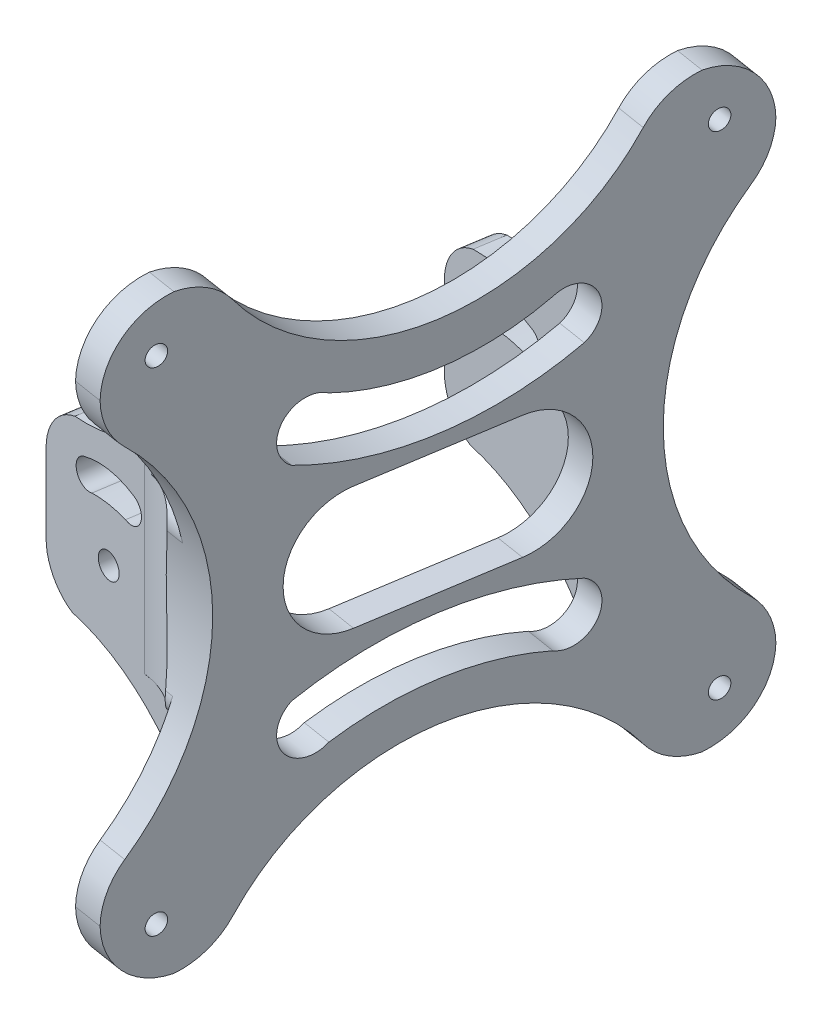
from build123d import *

# Parameters (mm, degrees)
ESQUISSE2_W                  = 37
ESQUISSE2_H                  = 36
ESQUISSE2_R                  = 2.55
BOSS_EXTRU_1_DEPTH           = 6
ESQUISSE8_W                  = 37
ESQUISSE8_H                  = 36
ESQUISSE8_R                  = 2.55
BOSS_EXTRU_3_DEPTH           = 6
ESQUISSE7_W                  = 120
ESQUISSE7_H                  = 120
ESQUISSE7_R                  = 2
BOSS_EXTRU_5_DEPTH           = 6
ESQUISSE13_W                 = 21.641206158
ESQUISSE13_H                 = 35.892950949
ESQUISSE13_W_2               = 21.658793842
ESQUISSE13_H_2               = 36.059743372
BOSS_EXTRU_6_DEPTH           = 13
ENL_V_MAT_EXTRU_1_DEPTH      = 13
ENL_V_MAT_EXTRU_1_DEPTH_BACK = 10
ENL_V_MAT_EXTRU_2_DEPTH      = 10
CONG_1_R                     = 14
CONG_2_R                     = 10
ESQUISSE16_W                 = 6
ESQUISSE16_H                 = 19
ESQUISSE16_H_2               = 20
BOSS_EXTRU_7_DEPTH           = 37
ENL_V_MAT_EXTRU_5_DEPTH      = 102
ESQUISSE11_R                 = 3.6
ENL_V_MAT_EXTRU_3_DEPTH      = 2
CONG_3_START                 = 37
CONG_3_DEPTH                 = 13
ENL_V_MAT_EXTRU_6_DEPTH      = 10
ENL_V_MAT_EXTRU_7_DEPTH      = 60


with BuildPart() as part:
    # Esquisse2 → Boss.-Extru.1 (new body)
    with BuildSketch(Plane(origin=(0.906224424, 0, -5.721675829), x_dir=(0.9876883405951378, 0, 0.15643446504023084), z_dir=(-0.15643446504023084, 0, 0.9876883405951378))):
        with Locations((31.5, -4.155063291)):
            Rectangle(ESQUISSE2_W, ESQUISSE2_H)
        with Locations(Location((28.3, -8.155063291, 0), (0, 0, 180))):
            Circle(ESQUISSE2_R, mode=Mode.SUBTRACT)
        with BuildLine():
            ThreePointArc((34.496035861, 7.577601288), (36.106578838, 3.890320367), (32.419297917, 2.27977739))
            ThreePointArc((32.419297917, 2.27977739), (28.322675088, 2.630124236), (24.226052259, 2.27977739))
            ThreePointArc((24.226052259, 2.27977739), (20.538771338, 3.890320367), (22.149314314, 7.577601288))
            ThreePointArc((22.149314314, 7.577601288), (28.322675088, 8.74435419), (34.496035861, 7.577601288))
        make_face(mode=Mode.SUBTRACT)
    extrude(amount=BOSS_EXTRU_1_DEPTH)



with BuildPart() as body_2:
    # Esquisse8 → Boss.-Extru.3 (new body)
    with BuildSketch(Plane(origin=(11.027534312, 0, -69.625111466), x_dir=(-0.9876883405951388, 0, -0.15643446504022476), z_dir=(0.15643446504022476, 0, -0.9876883405951388))):
        with Locations((-31.5, -4.155063291)):
            Rectangle(ESQUISSE8_W, ESQUISSE8_H)
        with Locations((-28.3, -8.155063291)):
            Circle(ESQUISSE8_R, mode=Mode.SUBTRACT)
        with BuildLine():
            ThreePointArc((-22.149314314, 7.577601288), (-20.538771338, 3.890320367), (-24.226052259, 2.27977739))
            ThreePointArc((-24.226052259, 2.27977739), (-28.322675088, 2.640604629), (-32.419297917, 2.27977739))
            ThreePointArc((-32.419297917, 2.27977739), (-36.106578838, 3.890320367), (-34.496035861, 7.577601288))
            ThreePointArc((-34.496035861, 7.577601288), (-28.322675088, 8.74435419), (-22.149314314, 7.577601288))
        make_face(mode=Mode.SUBTRACT)
    extrude(amount=BOSS_EXTRU_3_DEPTH)


with BuildPart() as part_1:
    add(part.part)

    add(body_2.part)  # Boss.-Extru.5 merges body 2
    # Esquisse7 → Boss.-Extru.5 (add)
    with BuildSketch(Plane(origin=(49.38441703, 0, 7.821723252), x_dir=(0.1564344650402309, 0, -0.9876883405951378), z_dir=(0.9876883405951379, 0, 0.1564344650402309))):
        with Locations((38.134203396, -0.53448162)):
            Rectangle(ESQUISSE7_W, ESQUISSE7_H)
        with Locations((-11.865796604, 49.46551838)):
            Circle(ESQUISSE7_R, mode=Mode.SUBTRACT)
        with Locations((88.134203396, 49.46551838)):
            Circle(ESQUISSE7_R, mode=Mode.SUBTRACT)
        with Locations((88.134203396, -50.53448162)):
            Circle(ESQUISSE7_R, mode=Mode.SUBTRACT)
        with Locations((-11.865796604, -50.53448162)):
            Circle(ESQUISSE7_R, mode=Mode.SUBTRACT)
    extrude(amount=BOSS_EXTRU_5_DEPTH)

    # Esquisse13 → Boss.-Extru.6 (add)
    with BuildSketch(Plane(origin=(49.38441703, 0, 7.821723252), x_dir=(-0.1564344650402309, 0, 0.9876883405951378), z_dir=(-0.9876883405951379, 0, -0.1564344650402309))):
        with Locations((-87.313600317, -4.101538765)):
            Rectangle(ESQUISSE13_W, ESQUISSE13_H)
        with Locations((11.036399683, -4.184934977)):
            Rectangle(ESQUISSE13_W_2, ESQUISSE13_H_2)
    extrude(amount=BOSS_EXTRU_6_DEPTH)

    # Esquisse9 → Enlèv. mat.-Extru.1 (cut, two sides: drawn at the far end of the back side and taken through both)
    with BuildSketch(Plane(origin=(49.38441703, 0, 7.821723252), x_dir=(-0.1564344650402309, 0, 0.9876883405951378), z_dir=(-0.9876883405951379, 0, -0.1564344650402309)).offset(-ENL_V_MAT_EXTRU_1_DEPTH_BACK)):
        with BuildLine():
            Line((-98.134203396, 39.46551838), (-98.134203396, -40.53448162))
            ThreePointArc((-98.134203396, -40.53448162), (-78.134203396, -0.53448162), (-98.134203396, 39.46551838))
        make_face()
        with BuildLine():
            Line((-78.134203396, -60.53448162), (1.865796604, -60.53448162))
            ThreePointArc((1.865796604, -60.53448162), (-38.134203396, -36.150009748), (-78.134203396, -60.53448162))
        make_face()
        with BuildLine():
            Line((21.865796604, 39.46551838), (21.865796604, -40.53448162))
            ThreePointArc((21.865796604, -40.53448162), (1.865796604, -0.53448162), (21.865796604, 39.46551838))
        make_face()
        with BuildLine():
            Line((1.865796604, 59.46551838), (-78.134203396, 59.46551838))
            ThreePointArc((-78.134203396, 59.46551838), (-38.134203396, 35.081046508), (1.865796604, 59.46551838))
        make_face()
    extrude(amount=ENL_V_MAT_EXTRU_1_DEPTH + ENL_V_MAT_EXTRU_1_DEPTH_BACK, mode=Mode.SUBTRACT)

    # Esquisse10 → Enlèv. mat.-Extru.2 (cut)
    with BuildSketch(Plane(origin=(49.38441703, 0, 7.821723252), x_dir=(-0.1564344650402309, 0, 0.9876883405951378), z_dir=(-0.9876883405951379, 0, -0.1564344650402309))):
        with BuildLine():
            Line((-53.134203396, 11.96551838), (-23.134203396, 11.96551838))
            ThreePointArc((-23.134203396, 11.96551838), (-10.634203396, -0.53448162), (-23.134203396, -13.03448162))
            Line((-23.134203396, -13.03448162), (-53.134203396, -13.03448162))
            ThreePointArc((-53.134203396, -13.03448162), (-65.634203396, -0.53448162), (-53.134203396, 11.96551838))
        make_face()
    extrude(amount=-ENL_V_MAT_EXTRU_2_DEPTH, mode=Mode.SUBTRACT)

    # Congé1
    # the kernel refuses this fillet: 14 mm, written as the material it takes off along each edge
    with BuildSketch(Plane(origin=(74.224993646, 59.46551838, 13.64513807), x_dir=(-0.156434465040231, -1.8269890380239846e-15, 0.9876883405951377), z_dir=(-0.9876883405951377, 0, -0.15643446504023098))) as cong_1_piece_1:
        with BuildLine():
            CenterArc((7.778292272, -14), CONG_1_R, 90, 54.076548206)
            ThreePointArc((-3.558929623, -5.786145868), (-1.67012678, -2.960324325), (0, 0))
            Line((0, 0), (7.778292272, 0))
        make_face()
    extrude(amount=44.891461359, mode=Mode.SUBTRACT)
    with BuildSketch(Plane(origin=(42.400977873, 59.46551838, -72.392500921), x_dir=(-0.0819572414762967, -0.8517749604527707, 0.517457657509556), z_dir=(0.9876883405951377, 0, 0.15643446504023104))) as cong_1_piece_2:
        with BuildLine():
            CenterArc((7.849741203, 13.960064244), CONG_1_R, 211.594748122, 54.076548206)
            Line((-4.075108243, 6.625354592), (0, 0))
            ThreePointArc((0, 0), (3.396522636, 0.128364929), (6.793045272, 0))
        make_face()
    extrude(amount=44.891461359, mode=Mode.SUBTRACT)
    with BuildSketch(Plane(origin=(30.166896719, 59.46551838, -94.579491533), x_dir=(-0.15643446504023087, 0, 0.9876883405951378), z_dir=(0.9876883405951378, 0, 0.15643446504023087))) as cong_1_piece_3:
        with BuildLine():
            CenterArc((CONG_1_R, CONG_1_R), CONG_1_R, 180, 90)
            Line((0, CONG_1_R), (0, 0))
            Line((0, 0), (CONG_1_R, 0))
        make_face()
    extrude(amount=76, mode=Mode.SUBTRACT)
    with BuildSketch(Plane(origin=(86.652299455, -40.53448162, -85.633082634), x_dir=(-0.11956994947595972, 0.6448071409611108, 0.7549349496134581), z_dir=(-0.9876883405951377, 0, -0.15643446504023106))) as cong_1_piece_4:
        with BuildLine():
            CenterArc((6.525192139, -13.977047442), CONG_1_R, 93.281319456, 46.567463442)
            Line((-4.175642183, -4.949747468), (0, 0))
            ThreePointArc((0, 0), (2.861926377, -0.081973422), (5.723852754, 0))
        make_face()
    extrude(amount=38.379000772, mode=Mode.SUBTRACT)
    with BuildSketch(Plane(origin=(48.745807869, 39.46551838, -91.636881088), x_dir=(0, 1, 0), z_dir=(0.9876883405951377, 0, 0.15643446504023104))) as cong_1_piece_5:
        with BuildLine():
            CenterArc((6.475800154, 14), CONG_1_R, 223.432536558, 46.567463442)
            ThreePointArc((-3.690781129, 4.375), (-1.782734564, 2.240357048), (0, 0))
            Line((0, 0), (6.475800154, 0))
        make_face()
    extrude(amount=38.379000772, mode=Mode.SUBTRACT)
    with BuildSketch(Plane(origin=(11.394760915, 59.46551838, 23.943109339), x_dir=(0.15643446504023087, 0, -0.9876883405951377), z_dir=(0.9876883405951378, 0, 0.15643446504023087)), Plane(origin=(30.166896719, -60.53448162, -94.579491533), x_dir=(-0.15643446504023087, 0, 0.9876883405951379), z_dir=(0.9876883405951378, 0, 0.15643446504023087)), Plane(origin=(11.394760915, -60.53448162, 23.943109339), x_dir=(0, 1, 0), z_dir=(0.9876883405951378, 0, 0.15643446504023087))) as cong_1_piece_6:
        with BuildLine():
            CenterArc((CONG_1_R, -CONG_1_R), CONG_1_R, 90, 90)
            Line((0, -CONG_1_R), (0, 0))
            Line((0, 0), (CONG_1_R, 0))
        make_face()
    extrude(amount=76, mode=Mode.SUBTRACT)
    with BuildSketch(Plane(origin=(67.880163651, -40.53448162, 32.889518238), x_dir=(0.1195699494759596, 0.6448071409611116, -0.7549349496134574), z_dir=(-0.9876883405951377, 0, -0.15643446504023104))) as cong_1_piece_7:
        with BuildLine():
            CenterArc((6.525192139, 13.977047442), CONG_1_R, 220.151217102, 46.567463442)
            Line((-4.175642183, 4.949747468), (0, 0))
            ThreePointArc((0, 0), (2.861926377, 0.081973422), (5.723852754, 0))
        make_face()
    extrude(amount=38.379000772, mode=Mode.SUBTRACT)
    with BuildSketch(Plane(origin=(29.973672064, 39.46551838, 26.885719783), x_dir=(0, 1, 0), z_dir=(0.9876883405951378, 0, 0.15643446504023087))) as cong_1_piece_8:
        with BuildLine():
            CenterArc((6.475800154, -14), CONG_1_R, 90, 46.567463442)
            ThreePointArc((-3.690781129, -4.375), (-1.782734564, -2.240357048), (0, 0))
            Line((0, 0), (6.475800154, 0))
        make_face()
    extrude(amount=38.379000772, mode=Mode.SUBTRACT)
    with BuildSketch(Plane(origin=(42.400977873, -60.53448162, -72.392500921), x_dir=(-0.0819572414762968, 0.8517749604527702, 0.5174576575095567), z_dir=(0.9876883405951377, 0, 0.15643446504023098))) as cong_1_piece_9:
        with BuildLine():
            CenterArc((7.849741203, -13.960064244), CONG_1_R, 94.328703672, 54.076548206)
            Line((-4.075108243, -6.625354592), (0, 0))
            ThreePointArc((0, 0), (3.396522636, -0.128364929), (6.793045272, 0))
        make_face()
    extrude(amount=44.891461359, mode=Mode.SUBTRACT)
    with BuildSketch(Plane(origin=(74.224993646, -60.53448162, 13.64513807), x_dir=(-0.15643446504023087, 0, 0.9876883405951378), z_dir=(-0.9876883405951378, 0, -0.1564344650402309))) as cong_1_piece_10:
        with BuildLine():
            CenterArc((7.778292272, 14), CONG_1_R, 215.923451794, 54.076548206)
            ThreePointArc((-3.558929623, 5.786145868), (-1.67012678, 2.960324325), (0, 0))
            Line((0, 0), (7.778292272, 0))
        make_face()
    extrude(amount=44.891461359, mode=Mode.SUBTRACT)

    # Congé2
    cong_2_edges = [part_1.edges().sort_by_distance(p)[0] for p in [
        (24.336786135, -22.155063291, -70.554528442),
        (24.336786135, 13.844936709, -70.554528442),
        (13.276869457, -22.155063291, -0.724962762),
        (13.276869457, 13.844936709, -0.724962762),
    ]]
    fillet(cong_2_edges, radius=CONG_2_R)

    # Esquisse16 → Boss.-Extru.7 (add)
    with BuildSketch(Plane(origin=(49.38441703, 0, 7.821723252), x_dir=(-0.1564344650402309, 0, 0.9876883405951378), z_dir=(-0.9876883405951379, 0, -0.1564344650402309))):
        with Locations((-73.492997238, -31.655063291)):
            Rectangle(ESQUISSE16_W, ESQUISSE16_H)
        with Locations((-73.492997238, 23.844936709)):
            Rectangle(ESQUISSE16_W, ESQUISSE16_H_2)
        with Locations((-2.792997238, 23.844936709)):
            Rectangle(ESQUISSE16_W, ESQUISSE16_H_2)
        with Locations((-2.792997238, -32.155063291)):
            Rectangle(ESQUISSE16_W, ESQUISSE16_H_2)
    extrude(amount=BOSS_EXTRU_7_DEPTH)

    # Esquisse17 → Enlèv. mat.-Extru.5 (cut)
    with BuildSketch(Plane(origin=(-0.032382366, 0, 0.204454215), x_dir=(0.9876883405951378, 0, 0.15643446504023087), z_dir=(-0.15643446504023087, 0, 0.9876883405951379))):
        with BuildLine():
            Line((50, 33.844936709), (13, 33.844936709))
            Line((13, 33.844936709), (13, 13.501075622))
            ThreePointArc((13, 13.501075622), (34.719017862, 17.818480301), (50, 33.844936709))
        make_face()
        with BuildLine():
            Line((13, -42.155063291), (13, -21.548289172))
            ThreePointArc((13, -21.548289172), (34.714338101, -26.080248397), (50, -42.155063291))
            Line((50, -42.155063291), (13, -42.155063291))
        make_face()
    extrude(amount=-ENL_V_MAT_EXTRU_5_DEPTH, mode=Mode.SUBTRACT)

    # Esquisse11 → Enlèv. mat.-Extru.3 (cut)
    with BuildSketch(Plane(origin=(49.38441703, 0, 7.821723252), x_dir=(-0.1564344650402309, 0, 0.9876883405951378), z_dir=(-0.9876883405951379, 0, -0.1564344650402309))):
        with Locations((-88.134203396, 49.46551838)):
            Circle(ESQUISSE11_R)
        with Locations((11.865796604, 49.46551838)):
            Circle(ESQUISSE11_R)
        with Locations((11.865796604, -50.53448162)):
            Circle(ESQUISSE11_R)
        with Locations((-88.134203396, -50.53448162)):
            Circle(ESQUISSE11_R)
    extrude(amount=-ENL_V_MAT_EXTRU_3_DEPTH, mode=Mode.SUBTRACT)

    # Congé3: read off the stored shape, not the designer's step
    # Congé3 outline → Congé3 (cut)
    with BuildSketch(Plane(origin=(0, 0, 0), x_dir=(0, 1, 0), z_dir=(0.9876883405951378, 0, 0.15643446504023098)).offset(CONG_3_START)):
        with BuildLine():
            ThreePointArc((13.844936709, 3.978091203), (11.573193704, 3.353899112), (9.274569567, 2.837411817))
            ThreePointArc((9.274569567, 2.837411817), (12.054573489, 2.381963558), (13.844936709, 0.207002762))
            Line((13.844936709, 0.207002762), (13.844936709, 3.978091203))
        make_face()
        with BuildLine():
            ThreePointArc((-22.214806663, 0.842212778), (-20.534438657, 4.100940661), (-16.905152956, 4.621737506))
            ThreePointArc((-16.905152956, 4.621737506), (-19.591434393, 5.639910447), (-22.214806663, 6.81068029))
            Line((-22.214806663, 6.81068029), (-22.214806663, 0.842212778))
        make_face()
        with BuildLine():
            ThreePointArc((13.844936709, -76.492997238), (12.052498388, -78.655940009), (9.279806235, -79.106866594))
            ThreePointArc((9.279806235, -79.106866594), (11.575784466, -79.622952584), (13.844936709, -80.246497996))
            Line((13.844936709, -80.246497996), (13.844936709, -76.492997238))
        make_face()
        with BuildLine():
            ThreePointArc((-22.04801424, -82.999206839), (-19.430319789, -81.84222461), (-16.750715527, -80.836912164))
            ThreePointArc((-16.750715527, -80.836912164), (-20.372966406, -80.308063186), (-22.04801424, -77.053128866))
            Line((-22.04801424, -77.053128866), (-22.04801424, -82.999206839))
        make_face()
    extrude(amount=CONG_3_DEPTH, mode=Mode.SUBTRACT)

    # Esquisse18 → Enlèv. mat.-Extru.6 (cut)
    with BuildSketch(Plane(origin=(49.38441703, 0, 7.821723252), x_dir=(-0.1564344650402309, 0, 0.9876883405951378), z_dir=(-0.9876883405951379, 0, -0.1564344650402309))):
        with BuildLine():
            ThreePointArc((-58.53089132, 30.635627759), (-38.689611602, 26.449223081), (-18.757961656, 30.181741726))
            ThreePointArc((-18.757961656, 30.181741726), (-10.465689701, 28.467978457), (-12.17945297, 20.175706502))
            ThreePointArc((-12.17945297, 20.175706502), (-38.142997238, 14.935009206), (-64.106541506, 20.175706502))
            ThreePointArc((-64.106541506, 20.175706502), (-66.548677041, 28.193492223), (-58.53089132, 30.635627759))
        make_face()
        with BuildLine():
            ThreePointArc((-58.53089132, -31.704590998), (-38.681843012, -28.198928976), (-18.757961656, -31.250704966))
            ThreePointArc((-18.757961656, -31.250704966), (-10.465689701, -29.536941697), (-12.17945297, -21.244669742))
            ThreePointArc((-12.17945297, -21.244669742), (-38.142997238, -16.518221403), (-64.106541506, -21.244669742))
            ThreePointArc((-64.106541506, -21.244669742), (-66.548677041, -29.262455463), (-58.53089132, -31.704590998))
        make_face()
    extrude(amount=-ENL_V_MAT_EXTRU_6_DEPTH, mode=Mode.SUBTRACT)

    # Esquisse19 → Enlèv. mat.-Extru.7 (cut)
    with BuildSketch(Plane.XZ.offset(22.214806663)):
        with BuildLine():
            Line((48.318991902, 14.548552766), (35.479043474, 12.51490472))
            Line((35.479043474, 12.51490472), (36.512086236, 5.992529421))
            ThreePointArc((36.512086236, 5.992529421), (43.580102839, 8.663498427), (48.318991902, 14.548552766))
        make_face()
        with BuildLine():
            Line((48.510609704, -69.763166303), (49.528405123, -76.189273667))
            Line((49.528405123, -76.189273667), (62.36835355, -74.155625622))
            ThreePointArc((62.36835355, -74.155625622), (56.005737643, -70.172918219), (48.510609704, -69.763166303))
        make_face()
    extrude(amount=-ENL_V_MAT_EXTRU_7_DEPTH, mode=Mode.SUBTRACT)


solid = part_1.part
